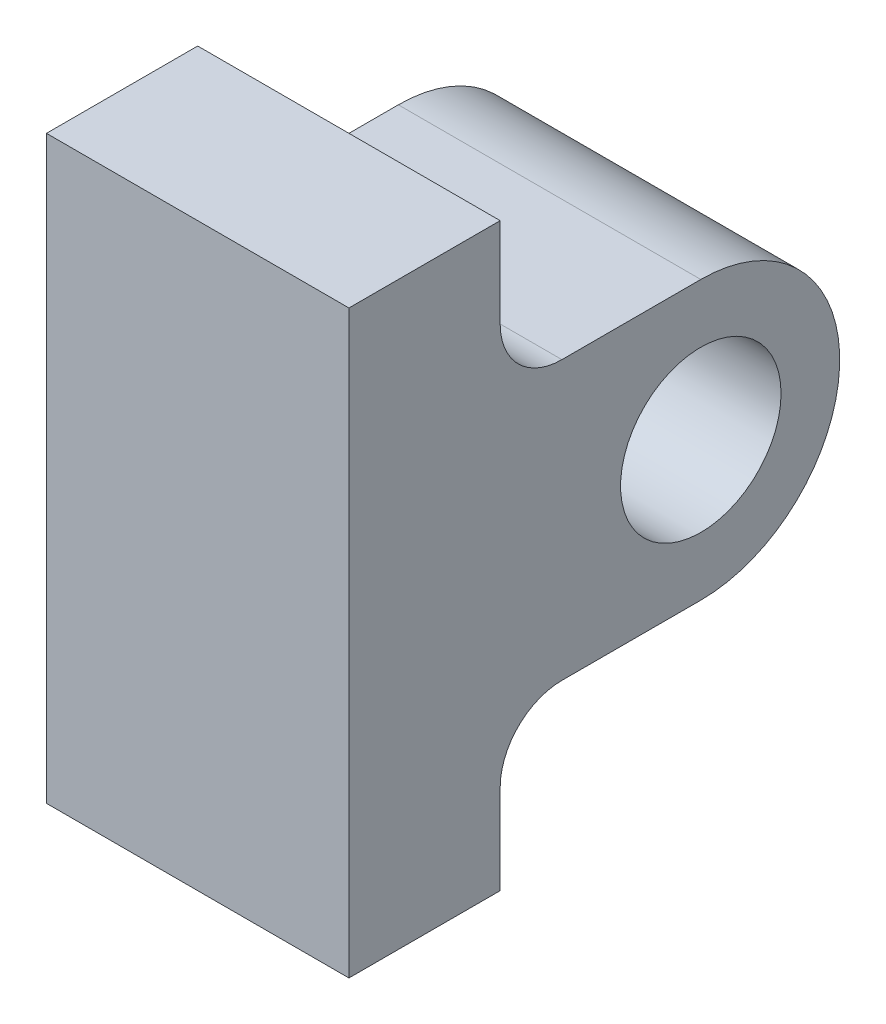
from build123d import *

# Parameters (mm, degrees)
SKETCH2_R           = 2.5
BOSS_EXTRUDE1_DEPTH = 5
MOVE_FACE1_BY       = 0.1
MOVE_FACE1_2_BY     = 0.1
MOVE_FACE1_3_BY     = 0.1
MOVE_FACE1_4_BY     = 0.1
MOVE_FACE1_5_BY     = 0.1
MOVE_FACE1_6_BY     = 0.1
FILLET2_R           = 2


with BuildPart() as part:
    # Sketch2 → Boss-Extrude1 (new, symmetric)
    with BuildSketch(Plane(origin=(0, 0, 0), x_dir=(0, 0, -1), z_dir=(1, 0, 0))):
        with BuildLine():
            Line((2.5, -4.5), (9, -4.5))
            ThreePointArc((9, -4.5), (13.5, 0), (9, 4.5))
            Line((9, 4.5), (2.5, 4.5))
            Line((2.5, 4.5), (2.5, 9.5))
            Line((2.5, 9.5), (-2.5, 9.5))
            Line((-2.5, 9.5), (-2.5, -9.5))
            Line((-2.5, -9.5), (2.5, -9.5))
            Line((2.5, -9.5), (2.5, -4.5))
        make_face()
        with Locations((9, 0)):
            Circle(SKETCH2_R, mode=Mode.SUBTRACT)
    extrude(amount=BOSS_EXTRUDE1_DEPTH, both=True)

    # Move Face1: a curved face moved inward by 0.1
    add(Solid.thicken(part.faces().sort_by_distance((0, 0, -6.5))[0], -MOVE_FACE1_BY), mode=Mode.SUBTRACT)

    # Move Face1 2: a face moved inward by 0.1
    extrude(part.faces().sort_by_distance((0, -9.5, 0))[0], amount=MOVE_FACE1_2_BY, dir=(0, 1, 0), mode=Mode.SUBTRACT)

    # Move Face1 3: a face moved inward by 0.1
    extrude(part.faces().sort_by_distance((0, 9.5, 0))[0], amount=MOVE_FACE1_3_BY, dir=(0, -1, 0), mode=Mode.SUBTRACT)

    # Move Face1 4: a face moved inward by 0.1
    extrude(part.faces().sort_by_distance((0, 0, 2.5))[0], amount=MOVE_FACE1_4_BY, dir=(0, 0, -1), mode=Mode.SUBTRACT)

    # Move Face1 5: a face moved inward by 0.1
    extrude(part.faces().sort_by_distance((-5, 0, -3.058349822))[0], amount=MOVE_FACE1_5_BY, dir=(1, 0, 0), mode=Mode.SUBTRACT)

    # Move Face1 6: a face moved inward by 0.1
    extrude(part.faces().sort_by_distance((5, 0, -3.058349822))[0], amount=MOVE_FACE1_6_BY, dir=(-1, 0, 0), mode=Mode.SUBTRACT)

    # Fillet2
    fillet2_edges = [part.edges().sort_by_distance(p)[0] for p in [
        (0, -4.5, -2.5),
        (0, 4.5, -2.5),
    ]]
    fillet(fillet2_edges, radius=FILLET2_R)


solid = part.part
